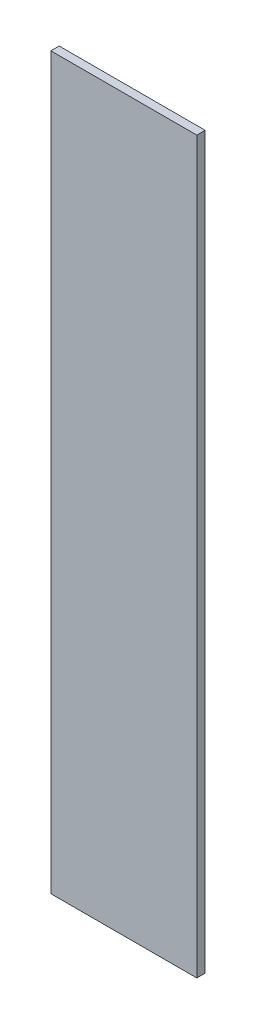
from build123d import *

# Parameters (mm, degrees)
SKETCH1_W           = 28
SKETCH1_H           = 140
BOSS_EXTRUDE1_DEPTH = 1.6


with BuildPart() as part:
    # Sketch1 → Boss-Extrude1 (new body)
    with BuildSketch(Plane.XY):
        with Locations((0, 70)):
            Rectangle(SKETCH1_W, SKETCH1_H)
    extrude(amount=BOSS_EXTRUDE1_DEPTH)


solid = part.part
